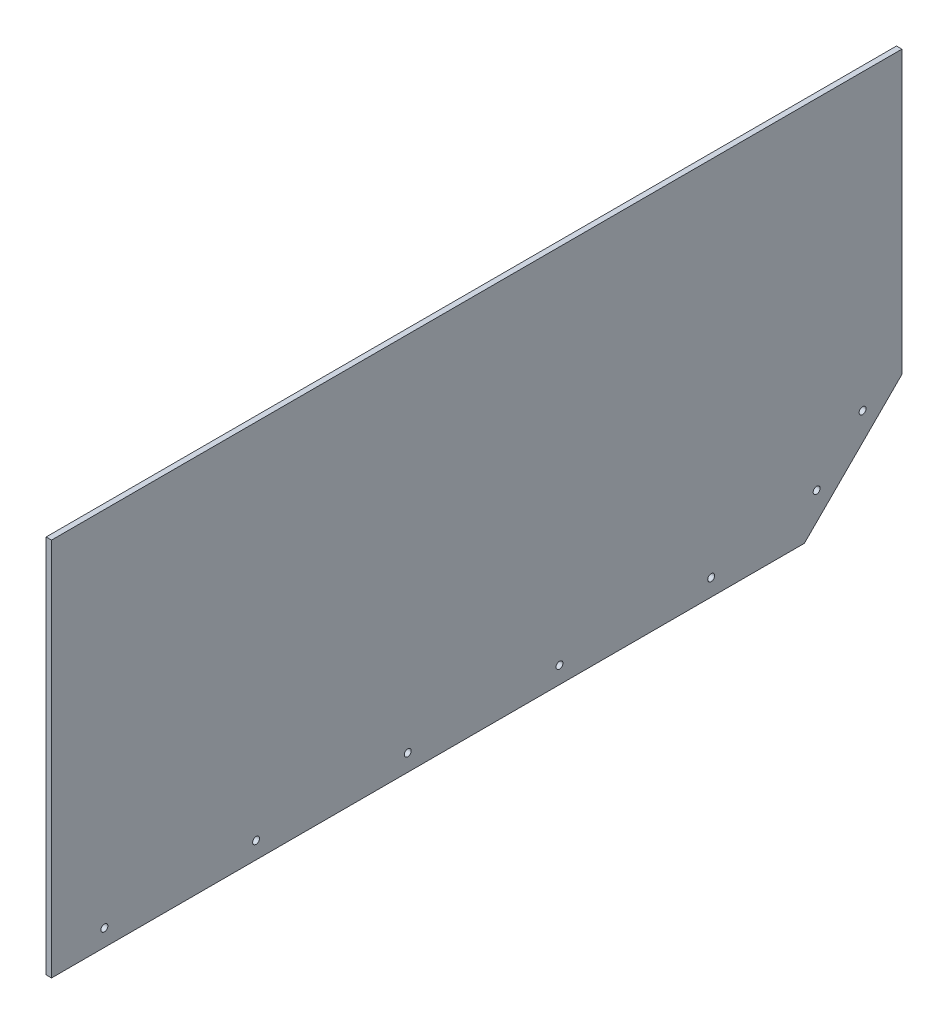
from build123d import *

# Parameters (mm, degrees)
SKETCH1_W           = 498.348
SKETCH1_H           = 165.1
BOSS_EXTRUDE1_DEPTH = 1.5875
BOSS_EXTRUDE2_DEPTH = 3.175
SKETCH3_R           = 2.025
CUT_EXTRUDE1_DEPTH  = 286.681383539
LPATTERN1_COUNT     = 5
LPATTERN1_PITCH     = 88.9
SKETCH4_R           = 2.025
CUT_EXTRUDE2_DEPTH  = 286.681383539
LPATTERN2_COUNT     = 2
LPATTERN2_PITCH     = 38.1


with BuildPart() as part:
    # Sketch1 → Boss-Extrude1 (new, symmetric)
    with BuildSketch(Plane(origin=(0, 0, 0), x_dir=(0, 0, -1), z_dir=(1, 0, 0))):
        Rectangle(SKETCH1_W, SKETCH1_H)
    extrude(amount=BOSS_EXTRUDE1_DEPTH, both=True)

    # Sketch2 → Boss-Extrude2 (add)
    with BuildSketch(Plane(origin=(1.5875, 0, 0), x_dir=(0, 0, -1), z_dir=(1, 0, 0))):
        Polygon((192.024, -139.7), (249.174, -82.55), (-249.174, -82.55), (-249.174, -139.7), align=None)
    extrude(amount=-BOSS_EXTRUDE2_DEPTH)

    # Sketch3 → Cut-Extrude1 (cut, through all)
    with BuildSketch(Plane.ZY.offset(1.5875)):
        with Locations((218.186, -129.794)):
            Circle(SKETCH3_R)
    cut_extrude1 = extrude(amount=-CUT_EXTRUDE1_DEPTH, mode=Mode.SUBTRACT)

    # LPattern1: Cut-Extrude1 ×5
    with Locations(*[(0, 0, -i * LPATTERN1_PITCH) for i in range(1, LPATTERN1_COUNT)]):
        add(cut_extrude1, mode=Mode.SUBTRACT)

    # Sketch4 → Cut-Extrude2 (cut, symmetric)
    with BuildSketch(Plane.ZY.offset(1.5875)):
        with Locations((-199.208204897, -116.351334085)):
            Circle(SKETCH4_R)
    cut_extrude2 = extrude(amount=CUT_EXTRUDE2_DEPTH, both=True, mode=Mode.SUBTRACT)

    # LPattern2: Cut-Extrude2 ×2
    with Locations(*[Vector(0, 0.7071067811865439, -0.7071067811865512) * (i * LPATTERN2_PITCH) for i in range(1, LPATTERN2_COUNT)]):
        add(cut_extrude2, mode=Mode.SUBTRACT)


solid = part.part
